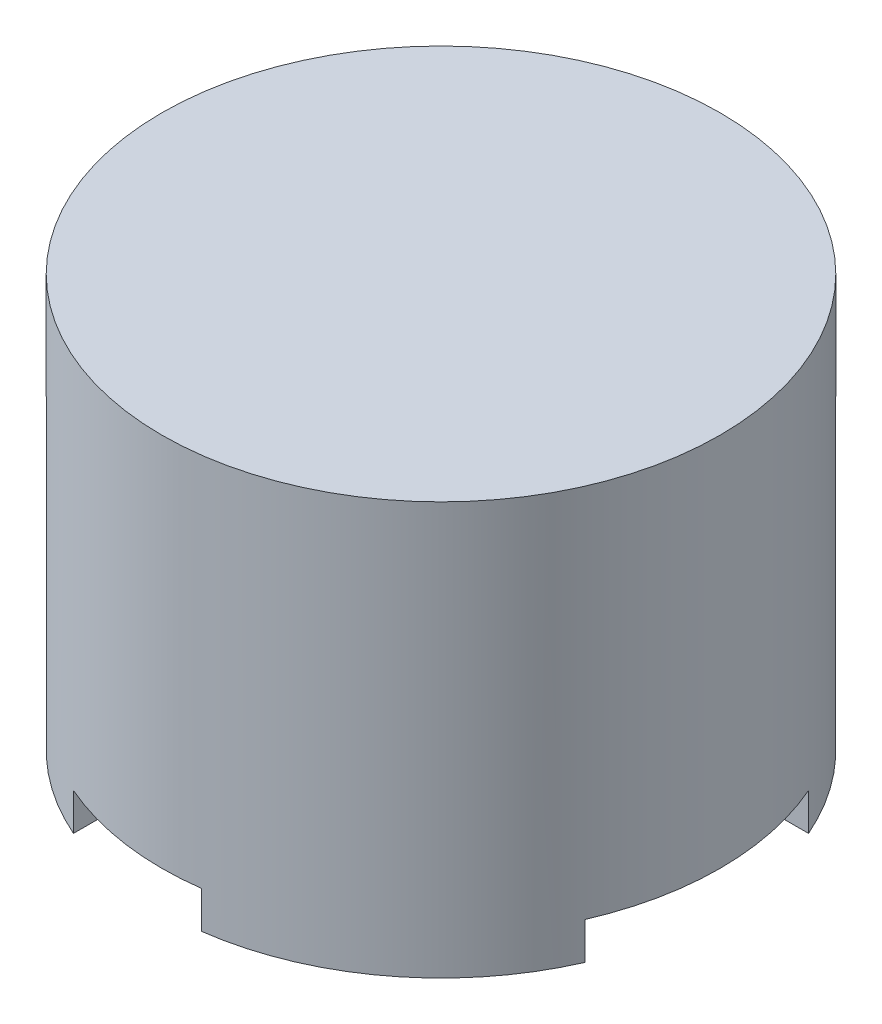
from build123d import *

# Parameters (mm, degrees)
FILLET1_R            = 4.064
SKETCH10_W           = 2.857500069
SKETCH10_H           = 7.5184
REVOLVE3_ANGLE       = 20
CUT_EXTRUDE1_START   = 1.27
CUT_EXTRUDE1_DEPTH   = 4.9784
CIRPATTERN4_COUNT    = 2
FILLET8_R            = 1.27
FILLET9_R            = 1.27
SKETCH13_W           = 23.8125
SKETCH13_H           = 35.179
SKETCH14_OUTSIDE_W   = 64.822
SKETCH14_OUTSIDE_H   = 64.822
SKETCH14_OUTSIDE_W_2 = 18.870013955
SKETCH14_OUTSIDE_H_2 = 18.870013955
SKETCH14_OUTSIDE_W_3 = 25.220013955
SKETCH14_OUTSIDE_H_3 = 25.220013955
CUT_EXTRUDE2_DEPTH   = 3.175


with BuildPart() as part:
    # Sketch1 → Revolve1 (revolve)
    with BuildSketch(Plane.XY, mode=Mode.PRIVATE) as revolve1_sk:
        Polygon((0, 9.1059), (-20.6375, 9.1059), (-20.6375, 5.042647059), (-17.78, 5.042647059), (-17.78, -5.042647059), (-20.6375, -5.042647059), (-20.6375, -19.7231), (-16.51, -19.7231), (-16.51, -15.5956), (-18.0975, -15.5956), (-18.0975, -13.3096), (-16.51, -13.3096), (-16.51, 6.7564), (-3.8481, 6.7564), (-3.0861, 7.5184), (0, 7.5184), align=None)
    revolve(revolve1_sk.sketch.rotate(Axis((0, 0, 0), (0, 1, 0)), 270), axis=Axis((0, 0, 0), (0, 1, 0)))

    # Fillet1
    # the kernel refuses this fillet: 4.064 mm, written as the material it takes off along each edge
    with BuildSketch(Plane(origin=(0, 9.1059, 0), x_dir=(0, 0, -1), z_dir=(1, 0, 0))) as fillet1_piece_1:
        with BuildLine():
            CenterArc((16.573500069, -4.064), FILLET1_R, 0.010532312, 89.989467688)
            Line((20.6375, -4.063252941), (20.718779999, -4.063238))
            Line((20.718779999, -4.063238), (20.71878, 0))
            Line((20.71878, 0), (20.6375, 0.08128))
            Line((20.6375, 0.08128), (16.573500069, 0.08128))
            Line((16.573500069, 0.08128), (16.573500069, 0))
        make_face()
    revolve(axis=Axis((0, 9.1059, 0), (0, 1, 0)), mode=Mode.SUBTRACT)

    # Sketch10 → Revolve3 (revolve, symmetric)
    with BuildSketch(Plane.XY) as revolve3_sk:
        with Locations((-19.208750034, 0)):
            Rectangle(SKETCH10_W, SKETCH10_H)
    revolve3 = revolve(axis=Axis((0, 0, 0), (0, 1, 0)), revolution_arc=REVOLVE3_ANGLE / 2)
    revolve3 = revolve3 + revolve(revolve3_sk.sketch, axis=Axis((0, 0, 0), (0, -1, 0)), revolution_arc=REVOLVE3_ANGLE / 2)

    # Sketch12 → Cut-Extrude1 (cut)
    with BuildSketch(Plane(origin=(0, -3.7592, 0), x_dir=(1, 0, 0), z_dir=(0, 1, 0)).offset(CUT_EXTRUDE1_START)):
        with BuildLine():
            Line((-7.313638514, 0), (-17.215440903, 1.745954919))
            ThreePointArc((-17.215440903, 1.745954919), (-17.30375, 0), (-17.215440903, -1.745954919))
            Line((-17.215440903, -1.745954919), (-7.313638514, 0))
        make_face()
    cut_extrude1 = extrude(amount=CUT_EXTRUDE1_DEPTH, mode=Mode.SUBTRACT)

    # CirPattern4: Revolve3, Cut-Extrude1 ×2 about axis
    cirpattern4_axis = Axis((0, 0, 0), (0, 1, 0))
    add([revolve3.rotate(cirpattern4_axis, i * 360 / CIRPATTERN4_COUNT) for i in range(1, CIRPATTERN4_COUNT)])
    add([cut_extrude1.rotate(cirpattern4_axis, i * 360 / CIRPATTERN4_COUNT) for i in range(1, CIRPATTERN4_COUNT)], mode=Mode.SUBTRACT)

    # Fillet8
    # the kernel refuses this fillet: 1.27 mm, written as the material it takes off along each edge
    with BuildSketch(Plane(origin=(-16.431533746, -2.4892, -1.607730937), x_dir=(0.1324793231915166, 0, -0.9911857691304479), z_dir=(0, 1, 0)), Plane(origin=(16.431533746, -2.4892, 1.607730937), x_dir=(-0.13247932319151873, 0, 0.9911857691304475), z_dir=(0, 1, 0))) as fillet8_piece_1:
        with BuildLine():
            CenterArc((1.211424462, 1.269207194), FILLET8_R, 201.909884157, 66.065503548)
            Line((0.033154154, 0.795309438), (0.009588748, 0.785831483))
            ThreePointArc((0.009588748, 0.785831483), (-0.008800881, 0.398712653), (-0.025377958, 0.001057934))
            Line((-0.025377958, 0.001057934), (0.000897351, -0.025384144))
            ThreePointArc((0.000897351, -0.025384144), (0.583278445, -0.01509352), (1.165659538, -0.025384144))
            Line((1.165659538, -0.025384144), (1.166556889, 0))
        make_face()
    extrude(amount=4.9784, mode=Mode.SUBTRACT)
    with BuildSketch(Plane(origin=(-16.431533746, -2.4892, 1.607730937), x_dir=(0.13247932319152245, 0, 0.9911857691304472), z_dir=(0, 1, 0)), Plane(origin=(16.431533746, -2.4892, -1.607730937), x_dir=(-0.13247932319151992, 0, -0.9911857691304475), z_dir=(0, 1, 0))) as fillet8_piece_2:
        with BuildLine():
            CenterArc((1.211424462, -1.269207194), FILLET8_R, 92.024612295, 66.065503548)
            Line((0.033154154, -0.795309438), (0.009588748, -0.785831483))
            ThreePointArc((0.009588748, -0.785831483), (-0.008800881, -0.398712653), (-0.025377958, -0.001057934))
            Line((-0.025377958, -0.001057934), (0.000897351, 0.025384144))
            ThreePointArc((0.000897351, 0.025384144), (0.583278445, 0.01509352), (1.165659538, 0.025384144))
            Line((1.165659538, 0.025384144), (1.166556889, 0))
        make_face()
    extrude(amount=4.9784, mode=Mode.SUBTRACT)

    # Fillet9
    fillet9_edges = [part.edges().sort_by_distance(p)[0] for p in [
        (-17.215440903, 0, 1.745954919),
        (-17.215440903, 0, -1.745954919),
        (17.215440903, 0, -1.745954919),
        (17.215440903, 0, 1.745954919),
    ]]
    fillet(fillet9_edges, radius=FILLET9_R)


with BuildPart() as body_2:
    # Sketch13 → Revolve4 (revolve)
    with BuildSketch(Plane.XY):
        with Locations((-11.90625, -5.3086)):
            Rectangle(SKETCH13_W, SKETCH13_H)
    revolve(axis=Axis((0, 12.2809, 0), (0, -1, 0)))

    # Intersect1: read off the stored shape, not the designer's step
    # Intersect1: cut part
    add(part.part, mode=Mode.SUBTRACT)

    # Sketch14 outside → Cut-Extrude2 (cut)
    with BuildSketch(Plane.XZ.offset(22.8981)):
        Rectangle(SKETCH14_OUTSIDE_W, SKETCH14_OUTSIDE_H)
        with Locations((-18.960006978, 18.960006978)):
            Rectangle(SKETCH14_OUTSIDE_W_2, SKETCH14_OUTSIDE_H_2, mode=Mode.SUBTRACT)
        with Locations((15.785006978, 18.960006978)):
            Rectangle(SKETCH14_OUTSIDE_W_3, SKETCH14_OUTSIDE_H_2, mode=Mode.SUBTRACT)
        with Locations((-18.960006978, -15.785006978)):
            Rectangle(SKETCH14_OUTSIDE_W_2, SKETCH14_OUTSIDE_H_3, mode=Mode.SUBTRACT)
        with Locations((18.960006978, -18.960006978)):
            Rectangle(SKETCH14_OUTSIDE_W_2, SKETCH14_OUTSIDE_H_2, mode=Mode.SUBTRACT)
    extrude(amount=-CUT_EXTRUDE2_DEPTH, mode=Mode.SUBTRACT)

    # Sketch15 → Cut-Revolve5 (revolve, cut)
    with BuildSketch(Plane.XY):
        Polygon((0, -22.8981), (20.6375, -22.8981), (20.6375, -19.7231), (17.504044696, -19.7231), (17.504044696, -16.22202595), (19.900999595, -16.22202595), (19.900999595, -12.241789307), (17.504044696, -12.241789307), (17.504044696, 7.5184), (0, 7.5184), align=None)
    revolve(axis=Axis((0, 0, 0), (0, -1, 0)), mode=Mode.SUBTRACT)


solid = body_2.part
